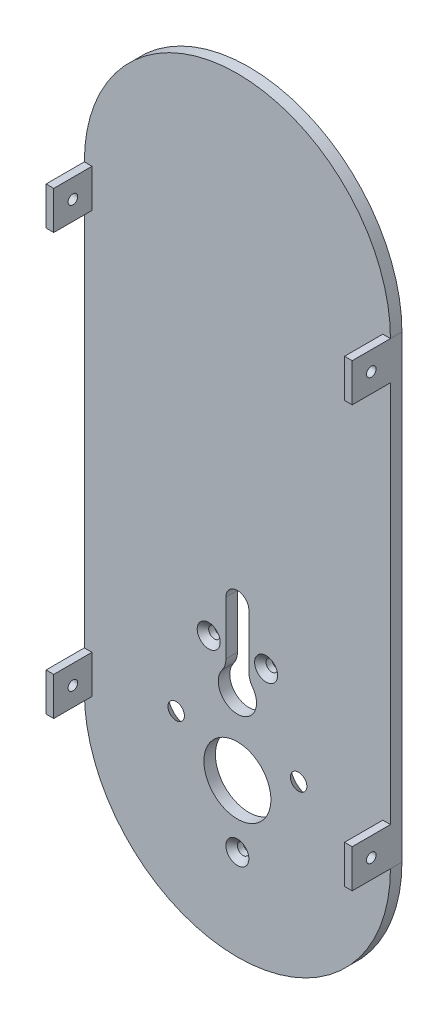
from build123d import *

# Parameters (mm, degrees)
SKETCH3_R           = 40
BOSS_EXTRUDE4_DEPTH = 3
SKETCH6_R           = 1.5
SKETCH6_R_2         = 8.75
CUT_EXTRUDE2_DEPTH  = 165.951508026
CHAMFER1_SIZE       = 1.5
SKETCH12_W          = 2
SKETCH12_H          = 10
BOSS_EXTRUDE7_DEPTH = 10
SKETCH13_R          = 1.25
CUT_EXTRUDE8_DEPTH  = 180.357185527
SKETCH14_R          = 2.15
CUT_EXTRUDE9_DEPTH  = 166.435788148
CHAMFER2_SIZE       = 3
CUT_EXTRUDE10_DEPTH = 166.435788148
FILLET1_R           = 5


with BuildPart() as part:
    # Sketch3 → Boss-Extrude4 (new body)
    with BuildSketch(Plane.XY):
        with BuildLine():
            ThreePointArc((40, 0), (0, 40), (-40, 0))
            Line((-40, 0), (40, 0))
        make_face()
        with BuildLine():
            Line((40, 0), (-40, 0))
            ThreePointArc((-40, 0), (0, -40), (40, 0))
        make_face()
        with BuildLine():
            Line((-40, 120), (-40, 0))
            ThreePointArc((-40, 0), (0, 40), (40, 0))
            Line((40, 0), (40, 120))
            ThreePointArc((40, 120), (0, 80), (-40, 120))
        make_face()
        with Locations((0, 120)):
            Circle(SKETCH3_R)
    extrude(amount=BOSS_EXTRUDE4_DEPTH)

    # Sketch6 → Cut-Extrude2 (cut, through all)
    with BuildSketch(Plane(origin=(0, 0, 0), x_dir=(-1, 0, 0), z_dir=(0, 0, -1))):
        with Locations((-7.5, 29.007101127)):
            Circle(SKETCH6_R)
        with Locations((7.5, 29.007101127)):
            Circle(SKETCH6_R)
        with Locations((0, -16.25)):
            Circle(SKETCH6_R)
        Circle(SKETCH6_R_2)
    extrude(amount=-CUT_EXTRUDE2_DEPTH, mode=Mode.SUBTRACT)

    # Chamfer1
    chamfer1_edges = [part.edges().sort_by_distance(p)[0] for p in [
        (-6, 29.007101127, 3),
        (1.5, -16.25, 3),
        (9, 29.007101127, 3),
    ]]
    chamfer(chamfer1_edges, length=CHAMFER1_SIZE)

    # Sketch12 → Boss-Extrude7 (add)
    with BuildSketch(Plane.XY.offset(3)):
        with Locations((39, 115)):
            Rectangle(SKETCH12_W, SKETCH12_H)
        with Locations((-39, 115)):
            Rectangle(SKETCH12_W, SKETCH12_H)
        with Locations((-39, 5)):
            Rectangle(SKETCH12_W, SKETCH12_H)
        with Locations((39, 5)):
            Rectangle(SKETCH12_W, SKETCH12_H)
    extrude(amount=BOSS_EXTRUDE7_DEPTH)

    # Sketch13 → Cut-Extrude8 (cut, through all)
    with BuildSketch(Plane.ZY.offset(40)):
        with Locations((8, 115)):
            Circle(SKETCH13_R)
        with Locations((8, 5)):
            Circle(SKETCH13_R)
    extrude(amount=-CUT_EXTRUDE8_DEPTH, mode=Mode.SUBTRACT)

    # Sketch14 → Cut-Extrude9 (cut, through all)
    with BuildSketch(Plane(origin=(0, 0, 0), x_dir=(-1, 0, 0), z_dir=(0, 0, -1))):
        with Locations((-16, 7.7)):
            Circle(SKETCH14_R)
        with Locations((16, 7.7)):
            Circle(SKETCH14_R)
    extrude(amount=-CUT_EXTRUDE9_DEPTH, mode=Mode.SUBTRACT)

    # Chamfer2
    chamfer2_edges = [part.edges().sort_by_distance(p)[0] for p in [
        (18.15, 7.7, 0),
        (-13.85, 7.7, 0),
    ]]
    chamfer(chamfer2_edges, length=CHAMFER2_SIZE - 0.0001)  # a hair under: the kernel refuses the full size

    # Sketch9 → Cut-Extrude10 (cut, through all)
    with BuildSketch(Plane(origin=(0, 0, 0), x_dir=(-1, 0, 0), z_dir=(0, 0, -1))):
        with BuildLine():
            ThreePointArc((3, 40), (0, 43), (-3, 40))
            Line((-3, 40), (-3, 24))
            ThreePointArc((-3, 24), (0, 15), (3, 24))
            Line((3, 24), (3, 40))
        make_face()
    extrude(amount=-CUT_EXTRUDE10_DEPTH, mode=Mode.SUBTRACT)

    # Fillet1
    fillet1_edges = [part.edges().sort_by_distance(p)[0] for p in [
        (3, 24, 1.5),
        (-3, 24, 1.5),
    ]]
    fillet(fillet1_edges, radius=FILLET1_R)


solid = part.part
